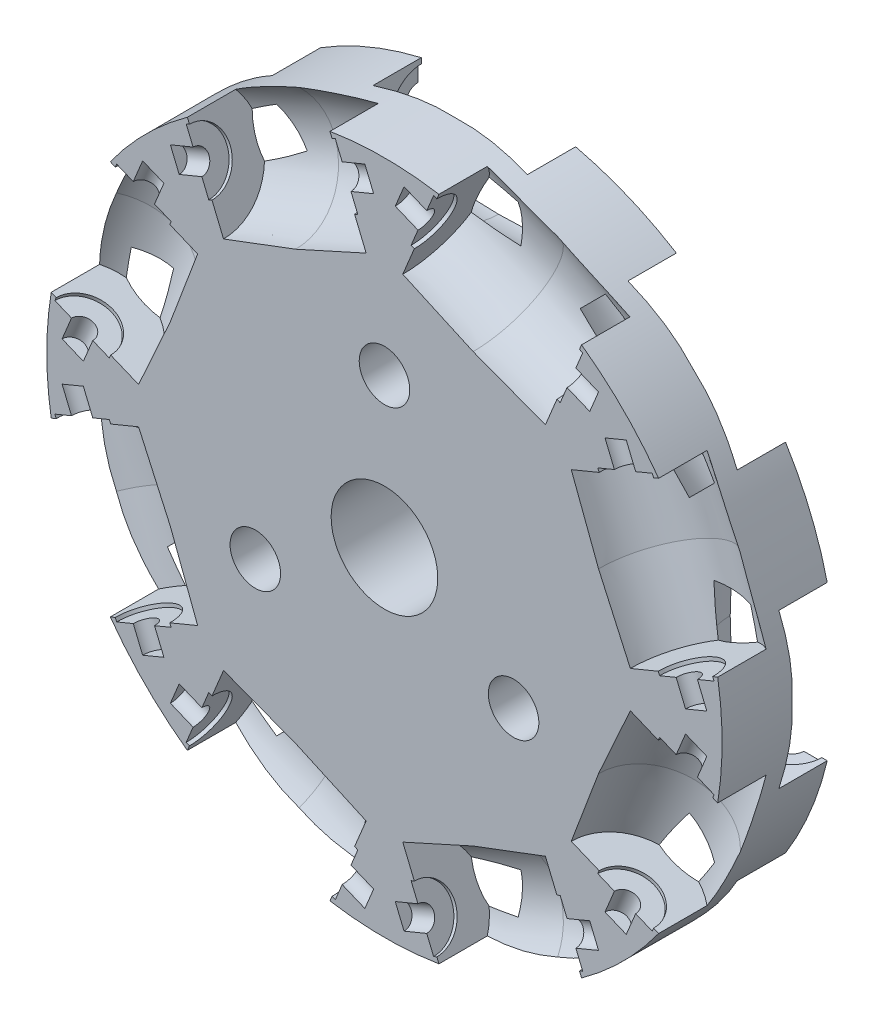
from build123d import *

# Parameters (mm, degrees)
SKETCH1_R           = 30.559375
BOSS_EXTRUDE1_DEPTH = 5.159375
CIRPATTERN1_COUNT   = 8
SKETCH4_R           = 2.286
CUT_EXTRUDE1_DEPTH  = 45.432278994
CIRPATTERN2_COUNT   = 3
SKETCH5_R           = 4.826
CUT_EXTRUDE2_DEPTH  = 45.432278994


with BuildPart() as part:
    # Sketch1 → Boss-Extrude1 (new, symmetric)
    with BuildSketch(Plane.XY):
        Circle(SKETCH1_R)
    extrude(amount=BOSS_EXTRUDE1_DEPTH, both=True)

    # Cavity2: read off the stored shape, not the designer's step
    # Cavity2 outline → Cavity2 (revolve, cut)
    with BuildSketch(Plane(origin=(-10.175791644, 24.566534194, 5.159375), x_dir=(-0.38268343236509117, 0.9238795325112862, 0), z_dir=(0, 0, -1))):
        Polygon((2.667, -6.985), (5.3975, -6.985), (5.61975, 0), (5.397499997, 6.985000107), (2.667, 6.985000107), (2.667, 7.3025), (1.0414, 7.3025), (1.0414, 9.525), (0, 9.525), (0, -9.525), (1.0414, -9.525), (1.0414, -7.3025), (2.667, -7.3025), align=None)
    cavity2 = revolve(axis=Axis((-10.175791644, 24.566534194, 5.159375), (0.9238795325112864, 0.3826834323650913, 0)), mode=Mode.SUBTRACT)

    # Cavity2 2 outline → Cavity2 2 (revolve, cut)
    with BuildSketch(Plane(origin=(0, 26.590625, -5.159375), x_dir=(0, 1, 0), z_dir=(0, 0, -1))):
        Polygon((2.667, -6.985), (5.3975, -6.985), (5.61975, 1e-09), (5.3975, 6.985), (2.667, 6.985), (2.667, 7.3025), (1.0414, 7.3025), (1.0414, 9.525), (0, 9.525), (0, -9.525), (1.0414, -9.525), (1.0414, -7.3025), (2.667, -7.3025), align=None)
    cavity2_2 = revolve(axis=Axis((0, 26.590625, -5.159375), (1, 0, 0)), mode=Mode.SUBTRACT)

    # CirPattern1: Cavity2, Cavity2 2 ×8 about axis
    cirpattern1_axis = Axis((0, 0, 0), (0, 0, 1))
    add([cavity2.rotate(cirpattern1_axis, i * 360 / CIRPATTERN1_COUNT) for i in range(1, CIRPATTERN1_COUNT)], mode=Mode.SUBTRACT)
    add([cavity2_2.rotate(cirpattern1_axis, i * 360 / CIRPATTERN1_COUNT) for i in range(1, CIRPATTERN1_COUNT)], mode=Mode.SUBTRACT)

    # Sketch4 → Cut-Extrude1 (cut, through all)
    with BuildSketch(Plane(origin=(0, 0, -5.159375), x_dir=(-1, 0, 0), z_dir=(0, 0, -1))):
        with Locations((0, 13.49375)):
            Circle(SKETCH4_R)
    cut_extrude1 = extrude(amount=-CUT_EXTRUDE1_DEPTH, mode=Mode.SUBTRACT)

    # CirPattern2: Cut-Extrude1 ×3 about axis
    cirpattern2_axis = Axis((0, 0, 0), (0, 0, 1))
    for i in range(1, CIRPATTERN2_COUNT):
        add(cut_extrude1.rotate(cirpattern2_axis, i * 360 / CIRPATTERN2_COUNT), mode=Mode.SUBTRACT)

    # Sketch5 → Cut-Extrude2 (cut, through all)
    with BuildSketch(Plane(origin=(0, 0, -5.159375), x_dir=(-1, 0, 0), z_dir=(0, 0, -1))):
        Circle(SKETCH5_R)
    extrude(amount=-CUT_EXTRUDE2_DEPTH, mode=Mode.SUBTRACT)


solid = part.part
